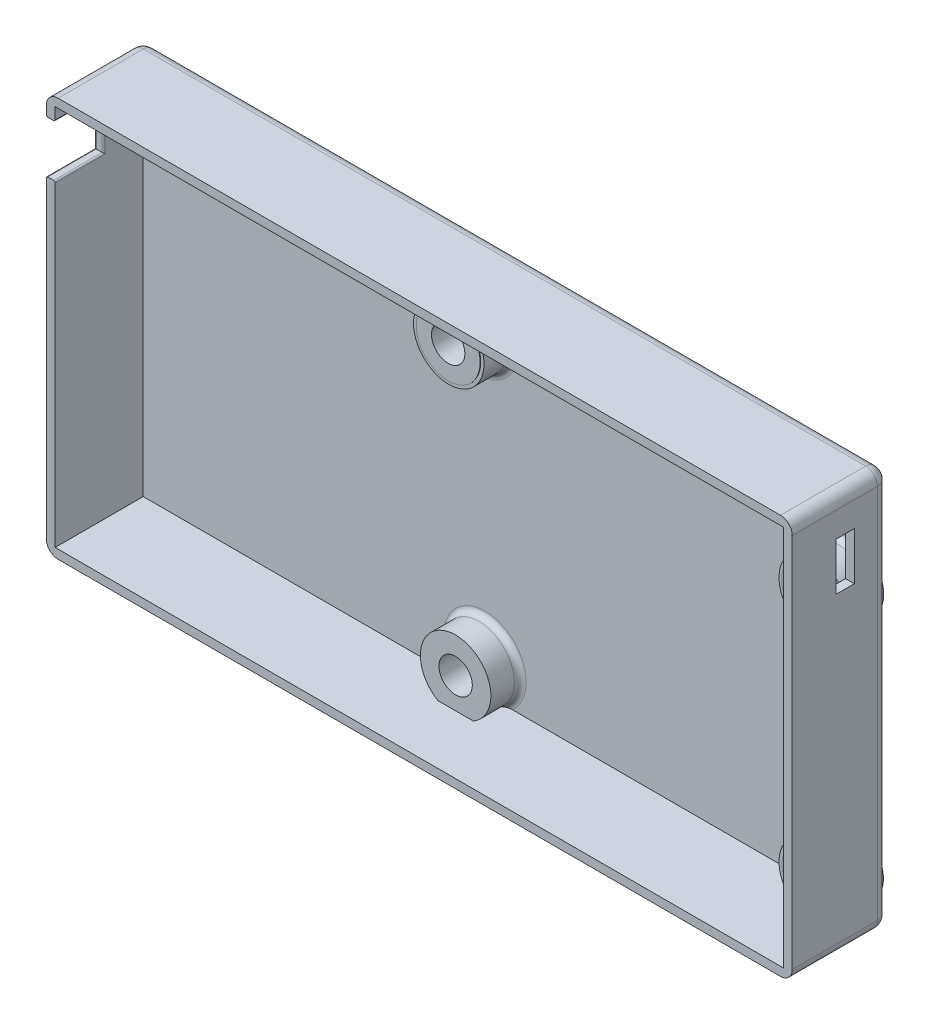
from build123d import *

# Parameters (mm, degrees)
ESQUISSE1_W                    = 124
ESQUISSE1_H                    = 65
BOSS_EXTRU_1_DEPTH             = 15
COQUE1_T                       = 1.5
BOSS_EXTRU_3_OUTLINE_R         = 6
BOSS_EXTRU_3_DEPTH             = 10
EMPREINTE1_START               = -10.100000008
EMPREINTE1_OUTLINE_R           = 2.839806331
EMPREINTE1_OUTLINE_R_2         = 6
EMPREINTE1_DEPTH               = 1.6
ENL_V_START                    = -5.1
ESQUISSE5_R                    = 6
ENL_V_MAT_EXTRU_1_DEPTH        = 5.1
BOSS_EXTRU_4_DEPTH             = 15.1
BOSS_EXTRU_5_DEPTH             = 15.1
BOSS_EXTRU_6_DEPTH             = 15.1
BOSS_EXTRU_7_DEPTH             = 15.1
CONG_1_R                       = 2
CONG_2_R                       = 2
CONG_3_R                       = 1
ESQUISSE11_W                   = 10.8
ESQUISSE11_H                   = 8.8
ENL_V_MAT_EXTRU_3_DEPTH        = 2.1
CONG_4_R                       = 0.25
CONG_5_R                       = 0.25
TROU_TARAUD_1_8_RC1_AT_2_COUNT = 2
TROU_TARAUD_1_8_RC1_AT_2_PITCH = 41.91
TROU_TARAUD_1_8_RC1_AT_3_COUNT = 2
TROU_TARAUD_1_8_RC1_AT_3_PITCH = 60.96
TROU_TARAUD_1_8_RC1_AT_4_COUNT = 2
TROU_TARAUD_1_8_RC1_AT_4_PITCH = 78.750241269
ESQUISSE18_W                   = 3.083291588
ESQUISSE18_H                   = 8.132762799
ENL_V_MAT_EXTRU_4_DEPTH        = 2.1
ESQUISSE19_R                   = 4.664213625
ESQUISSE19_R_2                 = 2.839806331
BOSS_EXTRU_8_DEPTH             = 6.5
BOSS_EXTRU_8_2_DEPTH           = 6.5
BOSS_EXTRU_8_3_DEPTH           = 6.5
BOSS_EXTRU_8_4_DEPTH           = 6.5
BOSS_EXTRU_9_START             = -6.5
ESQUISSE20_R                   = 5.379900666
ESQUISSE20_R_2                 = 4.217689817
ESQUISSE20_R_3                 = 6
ESQUISSE20_R_4                 = 3.772306099
ESQUISSE20_R_5                 = 5.431553005
ESQUISSE20_R_6                 = 3.80624141
ESQUISSE20_R_7                 = 5.440004475
ESQUISSE20_R_8                 = 3.679861135
BOSS_EXTRU_9_DEPTH             = 6.5


# Read off the part's stored shape, not the designer's step: Boss.-Extru.3, Empreinte1
with BuildPart() as part:
    # Esquisse1 → Boss.-Extru.1 (new body)
    with BuildSketch(Plane.XY):
        with Locations((62, 32.5)):
            Rectangle(ESQUISSE1_W, ESQUISSE1_H)
    extrude(amount=-BOSS_EXTRU_1_DEPTH)

    # Coque1
    coque1_openings = [part.faces().sort_by_distance(p)[0] for p in [
        (62, 32.5, 0),
    ]]
    offset(amount=COQUE1_T, openings=coque1_openings, kind=Kind.INTERSECTION)

    # Boss.-Extru.3 outline → Boss.-Extru.3 (add)
    with BuildSketch(Plane.XY.offset(-15)):
        with Locations((56.92, 53.455)):
            Circle(BOSS_EXTRU_3_OUTLINE_R)
        with BuildLine():
            Line((55.18800483, 0), (61.19199517, 0))
            ThreePointArc((61.19199517, 0), (58.19, 11.195), (55.18800483, 0))
        make_face()
        with BuildLine():
            Line((124, 1.662649508), (124, 8.727350492))
            ThreePointArc((124, 8.727350492), (114.68956929, 9.208048453), (116.14800483, 0))
            Line((116.14800483, 0), (122.15199517, 0))
            ThreePointArc((122.15199517, 0), (123.163048453, 0.73456929), (124, 1.662649508))
        make_face()
        with BuildLine():
            ThreePointArc((124, 50.637350492), (113.15, 47.105), (124, 43.572649508))
            Line((124, 43.572649508), (124, 50.637350492))
        make_face()
    extrude(amount=BOSS_EXTRU_3_DEPTH)

    # Empreinte1 outline → Empreinte1 (cut)
    # profile 1 of 4: a face of its own
    with BuildSketch(Plane.XY.offset(EMPREINTE1_START)):
        with BuildLine():
            ThreePointArc((52.921544138, 8.06612745), (53.45077676, 7.56461162), (52.732024523, 7.687088219))
            ThreePointArc((52.732024523, 7.687088219), (52.240505489, 4.418137681), (53.554927185, 1.385))
            Line((53.554927185, 1.385), (62.825072815, 1.385))
            ThreePointArc((62.825072815, 1.385), (61.545541614, 10.168966272), (52.921544138, 8.06612745))
        make_face()
        with Locations((58.19, 5.195)):
            Circle(EMPREINTE1_OUTLINE_R, mode=Mode.SUBTRACT)
    # profile 2 of 4: a face of its own
    with BuildSketch(Plane.XY.offset(EMPREINTE1_START)):
        with BuildLine():
            Line((114.514927185, 1.385), (119.15, 1.385))
            ThreePointArc((119.15, 1.385), (121.844076836, 2.500923164), (122.96, 5.195))
            Line((122.96, 5.195), (122.96, 9.830072815))
            ThreePointArc((122.96, 9.830072815), (114.907359313, 9.437640687), (114.514927185, 1.385))
        make_face()
        with Locations((119.15, 5.195)):
            Circle(EMPREINTE1_OUTLINE_R, mode=Mode.SUBTRACT)
    # profile 3 of 4: a face of its own
    with BuildSketch(Plane.XY.offset(EMPREINTE1_START)):
        with BuildLine():
            Line((122.96, 42.469927185), (122.96, 51.740072815))
            ThreePointArc((122.96, 51.740072815), (121.336087975, 52.692577236), (119.49694618, 53.09496063))
            ThreePointArc((119.49694618, 53.09496063), (119.15, 52.955), (118.80305382, 53.09496063))
            ThreePointArc((118.80305382, 53.09496063), (113.562422764, 44.918912025), (122.96, 42.469927185))
        make_face()
        with Locations((119.15, 47.105)):
            Circle(EMPREINTE1_OUTLINE_R, mode=Mode.SUBTRACT)
    # profile 4 of 4: a face of its own
    with BuildSketch(Plane.XY.offset(EMPREINTE1_START)):
        with Locations((56.92, 53.455)):
            Circle(EMPREINTE1_OUTLINE_R_2)
        with Locations((56.92, 53.455)):
            Circle(EMPREINTE1_OUTLINE_R, mode=Mode.SUBTRACT)
    extrude(amount=EMPREINTE1_DEPTH, mode=Mode.SUBTRACT)

    # Esquisse5 → Enlèv. mat.-Extru.1 (cut)
    with BuildSketch(Plane.XY.offset(-5).offset(ENL_V_START)):
        with Locations(Location((56.92, 53.455, 0), (0, 0, 180))):
            Circle(ESQUISSE5_R)
        with Locations((119.15, 47.105)):
            Circle(ESQUISSE5_R)
        with Locations((119.15, 5.195)):
            Circle(ESQUISSE5_R)
        with Locations((58.19, 5.195)):
            Circle(ESQUISSE5_R)
    extrude(amount=ENL_V_MAT_EXTRU_1_DEPTH, mode=Mode.SUBTRACT)

    # Esquisse7 → Boss.-Extru.4 (add)
    with BuildSketch(Plane.XY):
        with BuildLine():
            Line((122.15199517, 0), (116.14800483, 0))
            ThreePointArc((116.14800483, 0), (119.15, -0.831027818), (122.15199517, 0))
        make_face()
    extrude(amount=-BOSS_EXTRU_4_DEPTH)

    # Esquisse8 → Boss.-Extru.5 (add)
    with BuildSketch(Plane.XY):
        with BuildLine():
            Line((124, 1.662649508), (124, 8.727350492))
            ThreePointArc((124, 8.727350492), (125.234434393, 5.195), (124, 1.662649508))
        make_face()
    extrude(amount=-BOSS_EXTRU_5_DEPTH)

    # Esquisse9 → Boss.-Extru.6 (add)
    with BuildSketch(Plane.XY):
        with BuildLine():
            Line((124, 43.572649508), (124, 50.637350492))
            ThreePointArc((124, 50.637350492), (125.211874933, 47.105), (124, 43.572649508))
        make_face()
    extrude(amount=-BOSS_EXTRU_6_DEPTH)

    # Esquisse10 → Boss.-Extru.7 (add)
    with BuildSketch(Plane.XY):
        with BuildLine():
            Line((61.19199517, 0), (55.18800483, 0))
            ThreePointArc((55.18800483, 0), (58.19, -0.991074926), (61.19199517, 0))
        make_face()
    extrude(amount=-BOSS_EXTRU_7_DEPTH)

    # Congé1
    cong_1_edges = [part.edges().sort_by_distance(p)[0] for p in [
        (125.5, 32.5, -16.5),
        (62, 66.5, -16.5),
        (-1.5, 32.5, -16.5),
        (62, -1.5, -16.5),
    ]]
    fillet(cong_1_edges, radius=CONG_1_R)

    # Congé2
    # the kernel refuses this fillet: 2 mm, written as the material it takes off along each edge
    with BuildSketch(Plane(origin=(123.5, 64.5, -14.5), x_dir=(0, 1, 0), z_dir=(1, 0, 0))) as cong_2_piece_1_section:
        Polygon((0, 0), (CONG_2_R, 0), (CONG_2_R, -CONG_2_R), (0, -CONG_2_R), align=None)
    cong_2_piece_1 = extrude(amount=CONG_2_R, mode=Mode.PRIVATE)
    cong_2_piece_1 = cong_2_piece_1 - Plane(origin=(123.5, 64.5, -14.5), x_dir=(0, -0.7071067811865475, 0.7071067811865475), z_dir=(1, 0, 0)) * Sphere(CONG_2_R, mode=Mode.PRIVATE)
    add(cong_2_piece_1, mode=Mode.SUBTRACT)
    with BuildSketch(Plane(origin=(123.5, 0.5, -14.5), x_dir=(0, -1, 0), z_dir=(1, 0, 0))) as cong_2_piece_2_section:
        Polygon((0, 0), (CONG_2_R, 0), (CONG_2_R, CONG_2_R), (0, CONG_2_R), align=None)
    cong_2_piece_2 = extrude(amount=CONG_2_R, mode=Mode.PRIVATE)
    cong_2_piece_2 = cong_2_piece_2 - Plane(origin=(123.5, 0.5, -14.5), x_dir=(0, 0.7071067811865475, 0.7071067811865475), z_dir=(1, 0, 0)) * Sphere(CONG_2_R, mode=Mode.PRIVATE)
    add(cong_2_piece_2, mode=Mode.SUBTRACT)
    with BuildSketch(Plane(origin=(0.5, 64.5, -14.5), x_dir=(-1, 0, 0), z_dir=(0, 1, 0))) as cong_2_piece_3_section:
        Polygon((0, 0), (CONG_2_R, 0), (CONG_2_R, -CONG_2_R), (0, -CONG_2_R), align=None)
    cong_2_piece_3 = extrude(amount=CONG_2_R, mode=Mode.PRIVATE)
    cong_2_piece_3 = cong_2_piece_3 - Plane(origin=(0.5, 64.5, -14.5), x_dir=(0.7071067811865475, 0, 0.7071067811865475), z_dir=(0, 1, 0)) * Sphere(CONG_2_R, mode=Mode.PRIVATE)
    add(cong_2_piece_3, mode=Mode.SUBTRACT)
    with BuildSketch(Plane(origin=(0.5, 0.5, -14.5), x_dir=(-1, 0, 0), z_dir=(0, -1, 0))) as cong_2_piece_4_section:
        Polygon((0, 0), (CONG_2_R, 0), (CONG_2_R, CONG_2_R), (0, CONG_2_R), align=None)
    cong_2_piece_4 = extrude(amount=CONG_2_R, mode=Mode.PRIVATE)
    cong_2_piece_4 = cong_2_piece_4 - Plane(origin=(0.5, 0.5, -14.5), x_dir=(0.7071067811865475, 0, 0.7071067811865475), z_dir=(0, -1, 0)) * Sphere(CONG_2_R, mode=Mode.PRIVATE)
    add(cong_2_piece_4, mode=Mode.SUBTRACT)
    with BuildSketch(Plane(origin=(-1.5, 66.5, -14.5), x_dir=(1, 0, 0), z_dir=(0, 0, 1)), Plane(origin=(-1.5, -1.5, 5), x_dir=(1, 0, 0), z_dir=(0, 0, -1)), Plane(origin=(125.5, 66.5, -14.5), x_dir=(0, -1, 0), z_dir=(0, 0, 1))) as cong_2_piece_5:
        with BuildLine():
            CenterArc((CONG_2_R, -CONG_2_R), CONG_2_R, 90, 90)
            Line((0, -CONG_2_R), (0, 0))
            Line((0, 0), (CONG_2_R, 0))
        make_face()
    extrude(amount=19.5, mode=Mode.SUBTRACT)
    with BuildSketch(Plane(origin=(125.5, -1.5, -14.5), x_dir=(0, 1, 0), z_dir=(0, 0, 1))) as cong_2_piece_6:
        with BuildLine():
            CenterArc((CONG_2_R, CONG_2_R), CONG_2_R, 180, 90)
            Line((0, CONG_2_R), (0, 0))
            Line((0, 0), (CONG_2_R, 0))
        make_face()
    extrude(amount=19.5, mode=Mode.SUBTRACT)

    # Congé3
    cong_3_edges = [part.edges().sort_by_distance(p)[0] for p in [
        (50.92, 53.455, -15),
        (113.15, 47.105, -15),
        (114.68956929, 9.208048453, -15),
        (58.19, 11.195, -15),
    ]]
    fillet(cong_3_edges, radius=CONG_3_R)

    # Esquisse11 → Enlèv. mat.-Extru.3 (cut)
    with BuildSketch(Plane.ZY.offset(1.5)):
        with Locations((-2.850000008, 58.408)):
            Rectangle(ESQUISSE11_W, ESQUISSE11_H)
    extrude(amount=-ENL_V_MAT_EXTRU_3_DEPTH, mode=Mode.SUBTRACT)

    # Congé4
    cong_4_edges = [part.edges().sort_by_distance(p)[0] for p in [
        (-1.5, 62.808, -4.125000004),
        (-1.5, 58.408, -8.250000008),
        (-1.5, 54.008, -4.125000004),
    ]]
    fillet(cong_4_edges, radius=CONG_4_R)

    # Congé5
    cong_5_edges = [part.edges().sort_by_distance(p)[0] for p in [
        (0, 62.808, -4.125000004),
        (0, 58.408, -8.250000008),
        (0, 54.008, -4.125000004),
    ]]
    fillet(cong_5_edges, radius=CONG_5_R)

    # Esquisse17 → Trou taraudé 1/8 Rc1 (revolve, cut)
    with BuildSketch(Plane(origin=(119.15, 5.195, -10.100000008), x_dir=(0, -1, 0), z_dir=(1, 0, 0))):
        Polygon((0, 0), (0, 6.399999992), (3.95, 6.399999992), (3.95, 7.4), (4.632997004, 7.4), (4.864, 0), align=None)
    trou_taraud_1_8_rc1 = revolve(axis=Axis((119.15, 5.195, -3.750000008), (0, 0, -1)), mode=Mode.SUBTRACT)

    # Trou taraudé 1/8 Rc1 at 2: Trou taraudé 1/8 Rc1 ×2
    with Locations(*[(0, i * TROU_TARAUD_1_8_RC1_AT_2_PITCH, 0) for i in range(1, TROU_TARAUD_1_8_RC1_AT_2_COUNT)]):
        add(trou_taraud_1_8_rc1, mode=Mode.SUBTRACT)

    # Trou taraudé 1/8 Rc1 at 3: Trou taraudé 1/8 Rc1 ×2
    with Locations(*[(-i * TROU_TARAUD_1_8_RC1_AT_3_PITCH, 0, 0) for i in range(1, TROU_TARAUD_1_8_RC1_AT_3_COUNT)]):
        add(trou_taraud_1_8_rc1, mode=Mode.SUBTRACT)

    # Trou taraudé 1/8 Rc1 at 4: Trou taraudé 1/8 Rc1 ×2
    with Locations(*[Vector(-0.7902198011947434, 0.612823519293883, 0) * (i * TROU_TARAUD_1_8_RC1_AT_4_PITCH) for i in range(1, TROU_TARAUD_1_8_RC1_AT_4_COUNT)]):
        add(trou_taraud_1_8_rc1, mode=Mode.SUBTRACT)

    # Esquisse18 → Enlèv. mat.-Extru.4 (cut)
    with BuildSketch(Plane(origin=(125.5, 0, 0), x_dir=(0, 0, -1), z_dir=(1, 0, 0))):
        with Locations((9.038213341, 56.182347116)):
            Rectangle(ESQUISSE18_W, ESQUISSE18_H)
    extrude(amount=-ENL_V_MAT_EXTRU_4_DEPTH, mode=Mode.SUBTRACT)



with BuildPart() as body_2:
    # Esquisse19 → Boss.-Extru.8 (new body)
    with BuildSketch(Plane(origin=(0, 0, -16.5), x_dir=(-1, 0, 0), z_dir=(0, 0, -1))):
        with Locations((-58.19, 5.195)):
            Circle(ESQUISSE19_R)
        with Locations((-58.19, 5.195)):
            Circle(ESQUISSE19_R_2, mode=Mode.SUBTRACT)
    extrude(amount=-BOSS_EXTRU_8_DEPTH)


with BuildPart() as body_3:
    # Esquisse19 → Boss.-Extru.8 2 (new body)
    with BuildSketch(Plane(origin=(0, 0, -16.5), x_dir=(-1, 0, 0), z_dir=(0, 0, -1))):
        with Locations((-119.15, 5.195)):
            Circle(ESQUISSE19_R)
        with Locations((-119.15, 5.195)):
            Circle(ESQUISSE19_R_2, mode=Mode.SUBTRACT)
    extrude(amount=-BOSS_EXTRU_8_2_DEPTH)


with BuildPart() as body_4:
    # Esquisse19 → Boss.-Extru.8 3 (new body)
    with BuildSketch(Plane(origin=(0, 0, -16.5), x_dir=(-1, 0, 0), z_dir=(0, 0, -1))):
        with Locations((-119.15, 47.105)):
            Circle(ESQUISSE19_R)
        with Locations((-119.15, 47.105)):
            Circle(ESQUISSE19_R_2, mode=Mode.SUBTRACT)
    extrude(amount=-BOSS_EXTRU_8_3_DEPTH)


with BuildPart() as body_5:
    # Esquisse19 → Boss.-Extru.8 4 (new body)
    with BuildSketch(Plane(origin=(0, 0, -16.5), x_dir=(-1, 0, 0), z_dir=(0, 0, -1))):
        with Locations((-56.92, 53.455)):
            Circle(ESQUISSE19_R)
        with Locations((-56.92, 53.455)):
            Circle(ESQUISSE19_R_2, mode=Mode.SUBTRACT)
    extrude(amount=-BOSS_EXTRU_8_4_DEPTH)


with BuildPart() as part_1:
    add(part.part)

    add(body_2.part)  # Boss.-Extru.9 merges body 2

    add(body_3.part)  # Boss.-Extru.9 merges body 3

    add(body_4.part)  # Boss.-Extru.9 merges body 4

    add(body_5.part)  # Boss.-Extru.9 merges body 5
    # Esquisse20 → Boss.-Extru.9 (add)
    # profile 1 of 4: a face of its own
    with BuildSketch(Plane.XY.offset(-10).offset(BOSS_EXTRU_9_START)):
        with Locations((119.15, 5.195)):
            Circle(ESQUISSE20_R)
        with Locations((119.15, 5.195)):
            Circle(ESQUISSE20_R_2, mode=Mode.SUBTRACT)
    # profile 2 of 4: a face of its own
    with BuildSketch(Plane.XY.offset(-10).offset(BOSS_EXTRU_9_START)):
        with Locations((58.19, 5.195)):
            Circle(ESQUISSE20_R_3)
        with Locations((58.19, 5.195)):
            Circle(ESQUISSE20_R_4, mode=Mode.SUBTRACT)
    # profile 3 of 4: a face of its own
    with BuildSketch(Plane.XY.offset(-10).offset(BOSS_EXTRU_9_START)):
        with Locations((119.15, 47.105)):
            Circle(ESQUISSE20_R_5)
        with Locations((119.15, 47.105)):
            Circle(ESQUISSE20_R_6, mode=Mode.SUBTRACT)
    # profile 4 of 4: a face of its own
    with BuildSketch(Plane.XY.offset(-10).offset(BOSS_EXTRU_9_START)):
        with Locations((56.92, 53.455)):
            Circle(ESQUISSE20_R_7)
        with Locations((56.92, 53.455)):
            Circle(ESQUISSE20_R_8, mode=Mode.SUBTRACT)
    extrude(amount=BOSS_EXTRU_9_DEPTH)


solid = part_1.part
